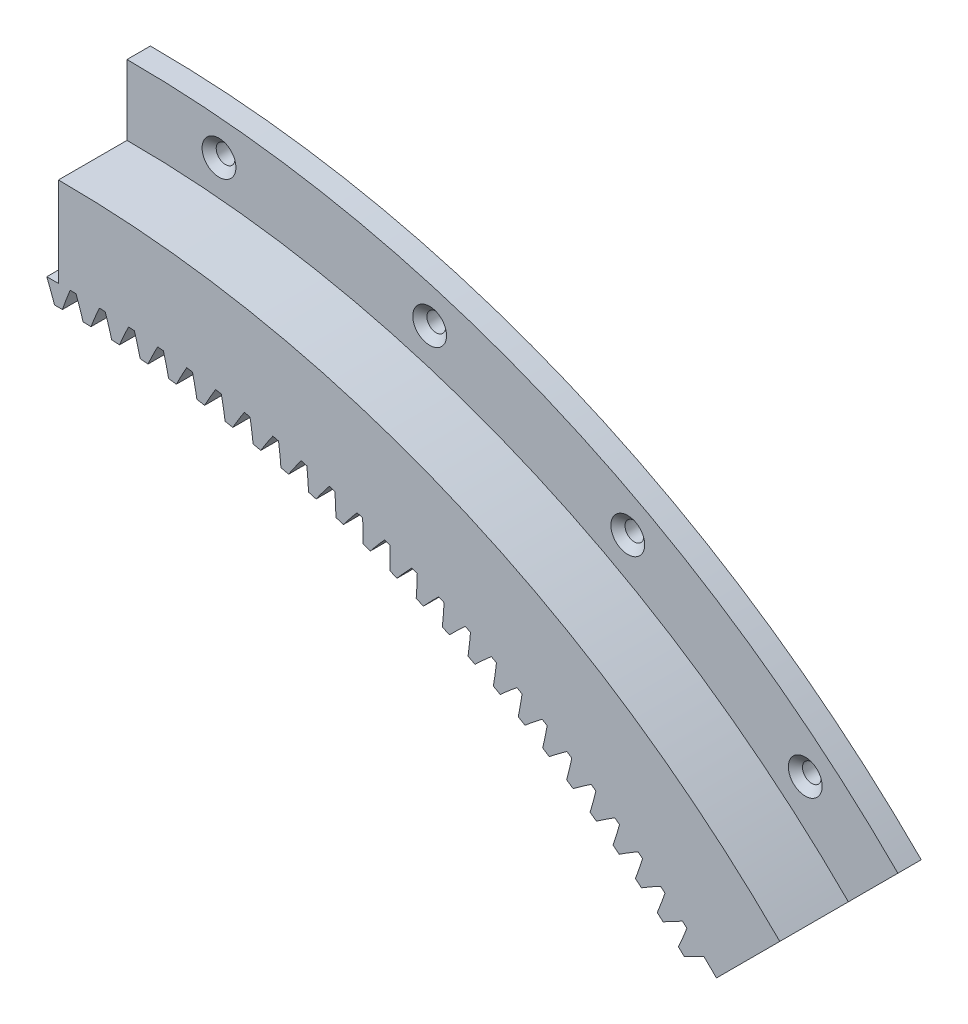
from build123d import *

# Parameters (mm, degrees)
SKETCH4_W           = 25
SKETCH4_H           = 24.37499982
REVOLVE1_ANGLE      = 45
BOSS_EXTRUDE1_DEPTH = 25
CIRPATTERN1_COUNT   = 25
CIRPATTERN1_ANGLE   = 43.2
SWEEP1_DEPTH        = 6.35
SKETCH18_R          = 2.54
CUT_EXTRUDE1_DEPTH  = 364.676609435
CHAMFER1_SIZE       = 2.0574
CHAMFER1_SIZE2      = 1.788470534


# Read off the part's stored shape, not the designer's step: Sweep1
with BuildPart() as part:
    # Sketch4 → Revolve1 (revolve)
    with BuildSketch(Plane(origin=(0, 0, 0), x_dir=(0, 0, -1), z_dir=(1, 0, 0))):
        with Locations((-12.5, 265.31250009)):
            Rectangle(SKETCH4_W, SKETCH4_H)
    revolve(axis=Axis((0, 0, 25), (0, 0, -1)), revolution_arc=REVOLVE1_ANGLE)

    # Sketch16 → Boss-Extrude1 (add)
    with BuildSketch(Plane(origin=(0, 0, 0), x_dir=(-1, 0, 0), z_dir=(0, 0, -1))):
        with BuildLine():
            ThreePointArc((-3.183813967, 253.104976333), (0, 253.12500018), (3.183813967, 253.104976333))
            ThreePointArc((3.183813967, 253.104976333), (2.085257529, 250.317161386), (1.070720498, 247.497683944))
            ThreePointArc((1.070720498, 247.497683944), (0, 247.5), (-1.070720498, 247.497683944))
            ThreePointArc((-1.070720498, 247.497683944), (-2.085257529, 250.317161386), (-3.183813967, 253.104976333))
        make_face()
    boss_extrude1 = extrude(amount=-BOSS_EXTRUDE1_DEPTH)

    # CirPattern1: Boss-Extrude1 ×25 about axis
    cirpattern1_axis = Axis((0, 0, 0), (0, 0, -1))
    for i in range(1, CIRPATTERN1_COUNT):
        add(boss_extrude1.rotate(cirpattern1_axis, i * CIRPATTERN1_ANGLE / (CIRPATTERN1_COUNT - 1)))

    # Sweep1 outline → Sweep1 (add)
    with BuildSketch(Plane.XY):
        with BuildLine():
            Line((196.222131779, 196.222131779), (209.692515961, 209.692515961))
            ThreePointArc((209.692515961, 209.692515961), (113.484771868, 273.976475366), (0, 296.55))
            Line((0, 296.55), (0, 277.5))
            ThreePointArc((0, 277.5), (106.194652481, 256.376570272), (196.222131779, 196.222131779))
        make_face()
    extrude(amount=SWEEP1_DEPTH)

    # Sketch18 → Cut-Extrude1 (cut, through all)
    with BuildSketch(Plane.XY.offset(6.35)):
        with Locations((25.015877062, 285.93278322)):
            Circle(SKETCH18_R)
        with Locations((82.319697869, 274.966939772)):
            Circle(SKETCH18_R)
        with Locations((136.222171127, 252.639804303)):
            Circle(SKETCH18_R)
        with Locations((184.49611367, 219.873906286)):
            Circle(SKETCH18_R)
    extrude(amount=-CUT_EXTRUDE1_DEPTH, mode=Mode.SUBTRACT)

    # Chamfer1
    chamfer1_edges = [part.edges().sort_by_distance(p)[0] for p in [
        (22.475877062, 285.93278322, 6.35),
        (79.779697869, 274.966939772, 6.35),
        (133.682171127, 252.639804303, 6.35),
        (181.95611367, 219.873906286, 6.35),
    ]]
    chamfer1_side = [part.faces().sort_by_distance(p)[0] for p in [
        (107.078815813, 258.511129376, 6.35),
    ]]
    chamfer(chamfer1_edges, length=CHAMFER1_SIZE, length2=CHAMFER1_SIZE2, reference=chamfer1_side[0])


solid = part.part
